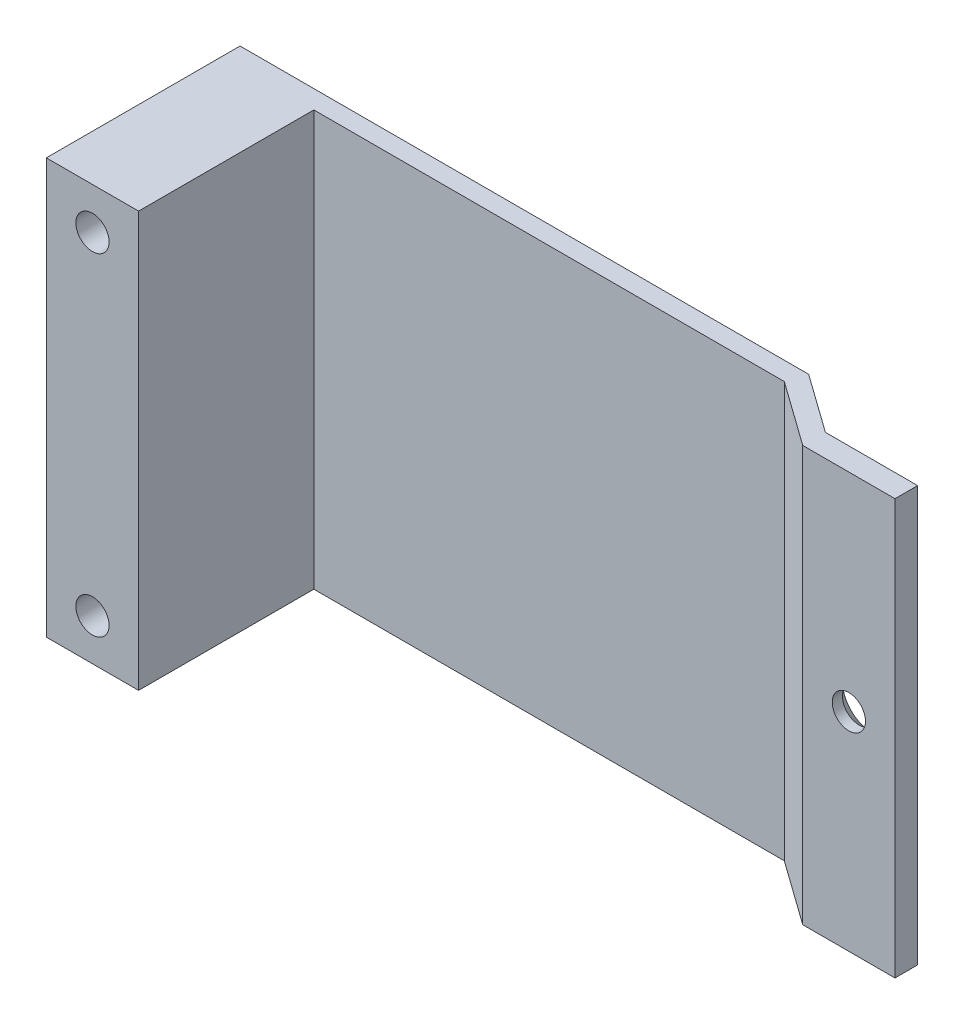
from build123d import *

# Parameters (mm, degrees)
SKETCH1_W                                           = 78
SKETCH1_H                                           = 45
SKETCH1_R                                           = 1.65
BOSS_EXTRUDE1_DEPTH                                 = 2
BOSS_EXTRUDE2_START                                 = 5
SKETCH1_3_W                                         = 10
SKETCH1_3_H                                         = 45
SKETCH1_3_R                                         = 1.65
BOSS_EXTRUDE2_DEPTH                                 = 5
BOSS_EXTRUDE3_START                                 = 19
SKETCH1_4_W                                         = 10
SKETCH1_4_H                                         = 45
SKETCH1_4_R                                         = 1.65
BOSS_EXTRUDE3_DEPTH                                 = 19
CHAMFER2_SIZE2                                      = 5
CHAMFER2_SIZE                                       = 7
CUT_EXTRUDE1_DEPTH                                  = 63
CSK_FOR_M3_COUNTERSUNK_FLAT_HEAD_SCREW1_D           = 3.6
CSK_FOR_M3_COUNTERSUNK_FLAT_HEAD_SCREW1_CSINK_D     = 6.3
CSK_FOR_M3_COUNTERSUNK_FLAT_HEAD_SCREW1_CSINK_ANGLE = 90
CSK_FOR_M3_COUNTERSUNK_FLAT_HEAD_SCREW2_D           = 3.6
CSK_FOR_M3_COUNTERSUNK_FLAT_HEAD_SCREW2_CSINK_D     = 6.3
CSK_FOR_M3_COUNTERSUNK_FLAT_HEAD_SCREW2_CSINK_ANGLE = 90


with BuildPart() as part:
    # Sketch1 → Boss-Extrude1 (new body)
    with BuildSketch(Plane.XY):
        Rectangle(SKETCH1_W, SKETCH1_H)
        with Locations((34, 0)):
            Circle(SKETCH1_R, mode=Mode.SUBTRACT)
        with Locations((-34, -18)):
            Circle(SKETCH1_R, mode=Mode.SUBTRACT)
        with Locations((-34, 18)):
            Circle(SKETCH1_R, mode=Mode.SUBTRACT)
    extrude(amount=-BOSS_EXTRUDE1_DEPTH)

    # Sketch1<3> → Boss-Extrude2 (add)
    # profile 1 of 2: a face of its own
    with BuildSketch(Plane.XY.offset(BOSS_EXTRUDE2_START)):
        with Locations((-34, 0)):
            Rectangle(SKETCH1_3_W, SKETCH1_3_H)
        with Locations((-34, -18)):
            Circle(SKETCH1_3_R, mode=Mode.SUBTRACT)
        with Locations((-34, 18)):
            Circle(SKETCH1_3_R, mode=Mode.SUBTRACT)
    # profile 2 of 2: a face of its own
    with BuildSketch(Plane.XY.offset(BOSS_EXTRUDE2_START)):
        with Locations((34, 0)):
            Rectangle(SKETCH1_3_W, SKETCH1_3_H)
        with Locations((34, 0)):
            Circle(SKETCH1_3_R, mode=Mode.SUBTRACT)
    extrude(amount=-BOSS_EXTRUDE2_DEPTH)

    # Sketch1<4> → Boss-Extrude3 (add)
    with BuildSketch(Plane.XY.offset(BOSS_EXTRUDE3_START)):
        with Locations((-34, 0)):
            Rectangle(SKETCH1_4_W, SKETCH1_4_H)
        with Locations((-34, -18)):
            Circle(SKETCH1_4_R, mode=Mode.SUBTRACT)
        with Locations((-34, 18)):
            Circle(SKETCH1_4_R, mode=Mode.SUBTRACT)
    extrude(amount=-BOSS_EXTRUDE3_DEPTH)

    # Chamfer2
    chamfer2_edges = [part.edges().sort_by_distance(p)[0] for p in [
        (29, 0, 0),
    ]]
    chamfer2_side = [part.faces().sort_by_distance(p)[0] for p in [
        (28.9, 0, 0),
    ]]
    chamfer(chamfer2_edges, length=CHAMFER2_SIZE - 0.0001, length2=CHAMFER2_SIZE2 - 0.0001, reference=chamfer2_side[0])  # a hair under: the kernel refuses the full size

    # Sketch2 → Cut-Extrude1 (cut)
    with BuildSketch(Plane.XZ.offset(22.5)):
        Polygon((22.640930107, -2), (29, 2.542192781), (39, 2.542192781), (39, -2), align=None)
    extrude(amount=-CUT_EXTRUDE1_DEPTH, mode=Mode.SUBTRACT)

    # CSK for M3 Countersunk Flat Head Screw1 (through all)
    with Locations(Plane(origin=(0, 0, 2.542192781), x_dir=(-1, 0, 0), z_dir=(0, 0, -1))):
        with Locations((-34, 0)):
            CounterSinkHole(CSK_FOR_M3_COUNTERSUNK_FLAT_HEAD_SCREW1_D / 2, CSK_FOR_M3_COUNTERSUNK_FLAT_HEAD_SCREW1_CSINK_D / 2, counter_sink_angle=CSK_FOR_M3_COUNTERSUNK_FLAT_HEAD_SCREW1_CSINK_ANGLE)

    # CSK for M3 Countersunk Flat Head Screw2 (through all)
    with Locations(Plane(origin=(0, 0, -2), x_dir=(-1, 0, 0), z_dir=(0, 0, -1))):
        with Locations((34, -18), (34, 18)):
            CounterSinkHole(CSK_FOR_M3_COUNTERSUNK_FLAT_HEAD_SCREW2_D / 2, CSK_FOR_M3_COUNTERSUNK_FLAT_HEAD_SCREW2_CSINK_D / 2, counter_sink_angle=CSK_FOR_M3_COUNTERSUNK_FLAT_HEAD_SCREW2_CSINK_ANGLE)


solid = part.part
